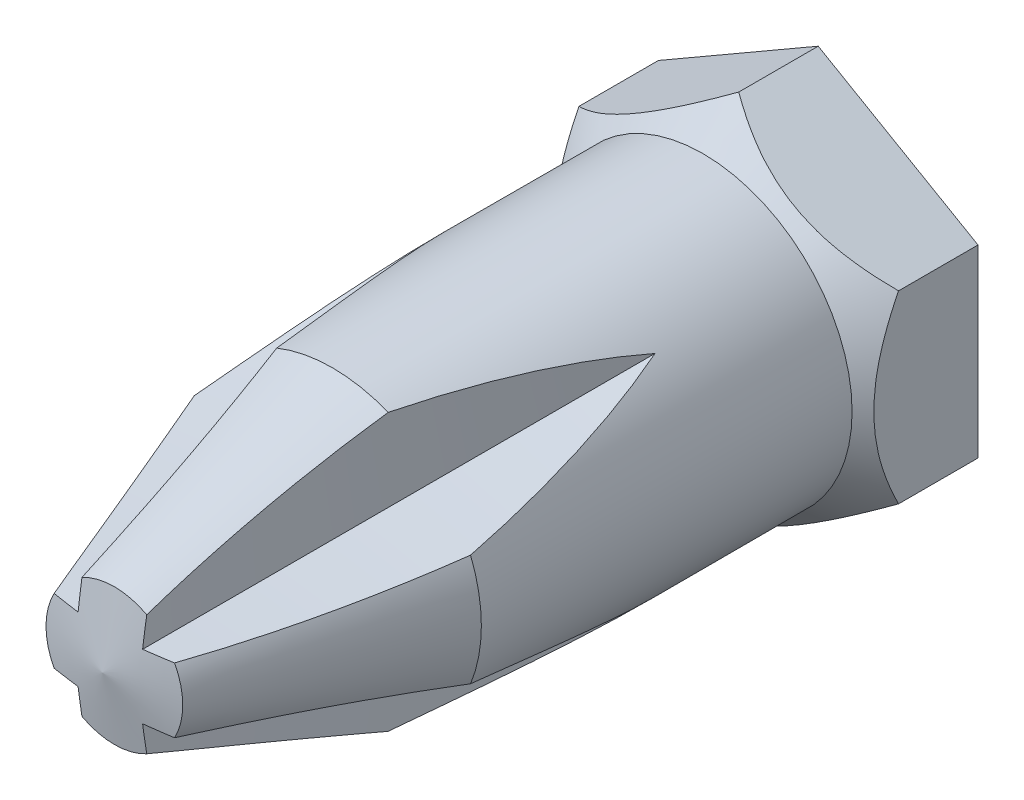
from build123d import *

# Parameters (mm, degrees)
SKETCH4_OUTSIDE_W  = 15.138
SKETCH4_OUTSIDE_H  = 15.138
CUT_EXTRUDE1_DEPTH = 13.462
SKETCH6_OUTSIDE_W  = 22.586
SKETCH6_OUTSIDE_H  = 23.568
SKETCH6_OUTSIDE_R  = 2.54
CUT_EXTRUDE6_DEPTH = 2.54
CUT_EXTRUDE6_DRAFT = -60
CIRPATTERN3_COUNT  = 4
SKETCH19_R         = 5.259957758
CUT_EXTRUDE7_DEPTH = 11.176


with BuildPart() as part:
    # Sketch3 → Revolve1 (revolve)
    with BuildSketch(Plane(origin=(0, 0, 0), x_dir=(0, 0, -1), z_dir=(1, 0, 0))):
        Polygon((-12.7, 0), (12.7, 0), (12.7, 3.81), (-0.762, 3.81), (-0.762, 2.9591), (-12.7, 2.9591), align=None)
    revolve(axis=Axis((0, 0, 12.7), (0, 0, -1)))

    # Sketch4 outside → Cut-Extrude1 (cut)
    with BuildSketch(Plane(origin=(0, 0, -12.7), x_dir=(-1, 0, 0), z_dir=(0, 0, -1))):
        Rectangle(SKETCH4_OUTSIDE_W, SKETCH4_OUTSIDE_H)
        Polygon((3.175, 1.833087105), (0, 3.666174209), (-3.175, 1.833087105), (-3.175, -1.833087105), (0, -3.666174209), (3.175, -1.833087105), align=None, mode=Mode.SUBTRACT)
    extrude(amount=-CUT_EXTRUDE1_DEPTH, mode=Mode.SUBTRACT)


with BuildPart() as cut_extrude6_tool:
    # Sketch6 outside → Cut-Extrude6 (with draft: the straight prism first)
    with BuildSketch(Plane(origin=(0, 0, -12.7), x_dir=(-1, 0, 0), z_dir=(0, 0, -1))):
        Rectangle(SKETCH6_OUTSIDE_W, SKETCH6_OUTSIDE_H)
        Circle(SKETCH6_OUTSIDE_R, mode=Mode.SUBTRACT)
    extrude(amount=-CUT_EXTRUDE6_DEPTH)
    # Cut-Extrude6: the draft: its side faces are tilted about the plane it starts from
    cut_extrude6_sides = [cut_extrude6_tool.faces().sort_by_distance(p)[0] for p in [
        (0, -11.784, -11.43),
        (-11.293, 0, -11.43),
        (0, 11.784, -11.43),
        (11.293, 0, -11.43),
        (2.54, 0, -11.43),
    ]]
    draft(cut_extrude6_sides, Plane(origin=(0, 0, -12.7), x_dir=(-1, 0, 0), z_dir=(0, 0, -1)), CUT_EXTRUDE6_DRAFT)


with BuildPart() as part_1:
    add(part.part)

    # Cut-Extrude6: cut by cut_extrude6_tool
    add(cut_extrude6_tool.part, mode=Mode.SUBTRACT)

    # Sketch12 → Cut-Revolve2 (revolve, cut)
    with BuildSketch(Plane(origin=(0, 0, 0), x_dir=(0, 0, -1), z_dir=(1, 0, 0))):
        Polygon((-0.762, 2.9591), (-0.762, 3.666174209), (-0.054925791, 3.666174209), align=None)
    revolve(axis=Axis((0, 0, 12.7), (0, 0, -1)), mode=Mode.SUBTRACT)

    # Cut-Sweep3: sweep along a path in Sketch10
    with BuildLine(Plane(origin=(0, 0, 0), x_dir=(0, 0, -1), z_dir=(0.7071067811865464, -0.7071067811865488, 0))) as cut_sweep3_path:
        ThreePointArc((-12.7, 0.898025612), (-8.161677229, 1.526035155), (-3.81, 2.9591))
    # Sketch7 → Cut-Sweep3 (sweep, cut)
    with BuildSketch(Plane.XY.offset(12.7)):
        with BuildLine():
            Line((0.635, 3.144163976), (0.635, 0.635))
            Line((0.635, 0.635), (3.144163976, 0.635))
            ThreePointArc((3.144163976, 0.635), (2.268148155, 2.268148155), (0.635, 3.144163976))
        make_face()
    cut_sweep3 = sweep(path=cut_sweep3_path.line, mode=Mode.SUBTRACT)

    # CirPattern3: Cut-Sweep3 ×4 about axis
    cirpattern3_axis = Axis((0, 0, 12.7), (0, 0, -1))
    for i in range(1, CIRPATTERN3_COUNT):
        add(cut_sweep3.rotate(cirpattern3_axis, i * 360 / CIRPATTERN3_COUNT), mode=Mode.SUBTRACT)

    # Sketch11 → Cut-Revolve1 (revolve, cut)
    with BuildSketch(Plane(origin=(0, 0, 0), x_dir=(1, 0, 0), z_dir=(0, 1, 0))):
        Polygon((1.27, -12.7), (2.9591, -8.128), (2.9591, -12.7), align=None)
    revolve(axis=Axis((0, 0, 12.7), (0, 0, -1)), mode=Mode.SUBTRACT)

    # Sketch13 → Cut-Revolve4 (revolve, cut)
    with BuildSketch(Plane(origin=(0, 0, 0), x_dir=(0, 0, -1), z_dir=(1, 0, 0))):
        Polygon((-12.7, 0.00254), (-12.46093948, 1.358319581), (-12.7, 1.358319581), align=None)
    revolve(axis=Axis((0, 0, 12.7), (0, 0, -1)), mode=Mode.SUBTRACT)

    # Sketch16 → Cut-Revolve5 (revolve, cut)
    with BuildSketch(Plane(origin=(0, 0, 0), x_dir=(0, 0, -1), z_dir=(1, 0, 0))):
        Polygon((4.7625, 3.666174209), (4.7625, 3.412174209), (5.3975, 3.666174209), align=None)
    revolve(axis=Axis((0, 0, 12.7), (0, 0, -1)), mode=Mode.SUBTRACT)

    # Sketch19 → Cut-Extrude7 (cut)
    with BuildSketch(Plane(origin=(0, 0, -12.7), x_dir=(-1, 0, 0), z_dir=(0, 0, -1))):
        Circle(SKETCH19_R)
    extrude(amount=-CUT_EXTRUDE7_DEPTH, mode=Mode.SUBTRACT)


solid = part_1.part
